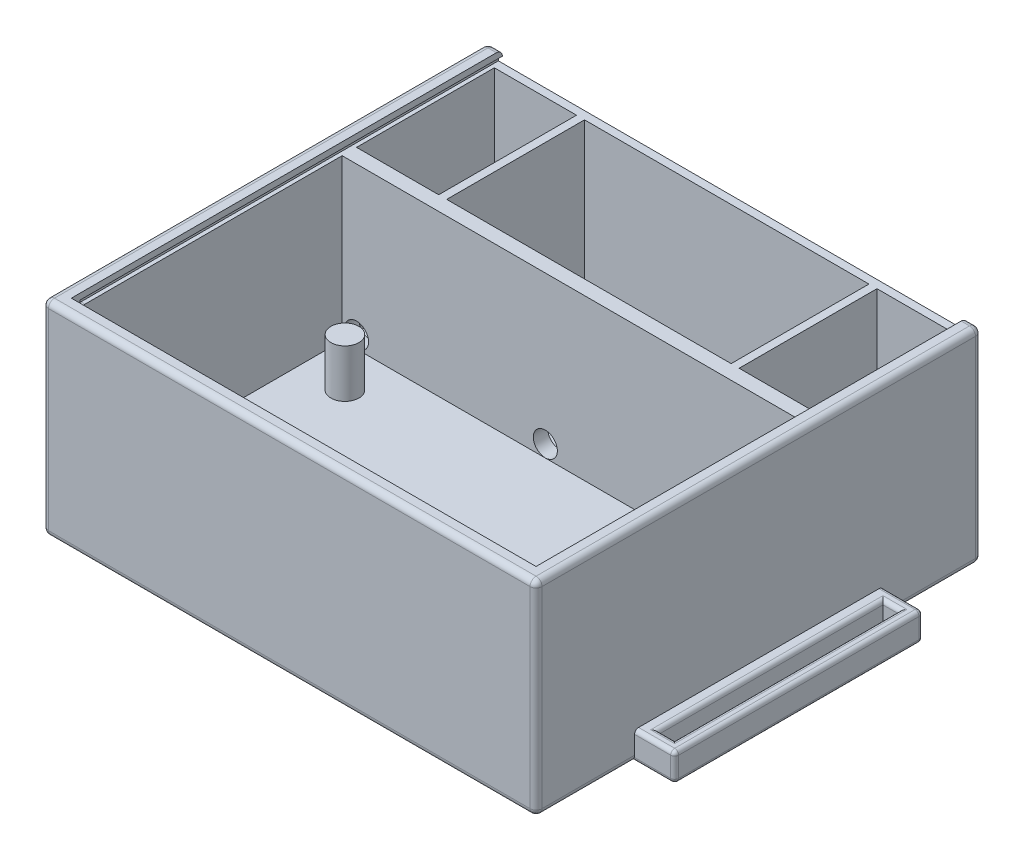
from build123d import *

# Parameters (mm, degrees)
EXTRUDE_THIN1_DEPTH     = 20
ESP_W                   = 57.99999999999999
ESP_H                   = 33.8
EXTRUDE_THIN2_DEPTH     = 20
BOSS_EXTRUDE1_DEPTH     = 4
BOSS_EXTRUDE2_START     = -20
BOSS_EXTRUDE2_DEPTH     = 20
SKETCH5_R               = 9.500000000000002
CUT_EXTRUDE1_DEPTH      = 2
SKETCH7_W               = 1.5
SKETCH7_H               = 9.000000000000004
CUT_EXTRUDE2_DEPTH      = 3.8
CUT_EXTRUDE3_REACH      = 73.504
CUT_EXTRUDE4_REACH      = 74.411
SKETCH9_R               = 1.5000000000000007
SKETCH9_R_2             = 1.5000000000000009
SKETCH9_R_3             = 1.500000000000004
FILLET4_R               = 2
FILLET5_R               = 5
FILLET6_R               = 1
BOSS_EXTRUDE3_DEPTH     = 1.5
CUT_EXTRUDE5_DEPTH      = 0.5
BOSS_EXTRUDE4_DEPTH     = 5
CUT_EXTRUDE6_REACH      = 89.049
SKETCH16_W              = 2
SKETCH16_H              = 27.999999999999993
FILLET8_R               = 0.5
FILLET11_R              = 0.75
SKETCH17_R              = 1.7500000000000038
SKETCH17_R_2            = 1.750000000000002
SKETCH17_R_3            = 1.7499999999999998
SKETCH17_R_4            = 1.7500000000000036
BOSS_EXTRUDE5_DEPTH     = 6
BOSS_EXTRUDE7_START     = -38
BOSS_EXTRUDE7_OUTLINE_R = 1.5
BOSS_EXTRUDE7_DEPTH     = 39
FILLET18_START          = -0.5
FILLET18_DEPTH          = 59
FILLET18_START_2        = -1
FILLET18_2_DEPTH        = 1
FILLET18_START_3        = 58
FILLET18_3_DEPTH        = 1


with BuildPart() as part:
    # Bat → Extrude-Thin1 (new body)
    with BuildSketch(Plane(origin=(0, 0, 0), x_dir=(1, 0, 0), z_dir=(0, 1, 0))):
        Polygon((11.25, 34.8), (11.25, 52.8), (46.75, 52.8), (46.75, 34.8), (47.75, 34.8), (47.75000000000001, 53.8), (10.25, 53.8), (10.25, 34.8), align=None)
    extrude(amount=EXTRUDE_THIN1_DEPTH)

    # ESP → Extrude-Thin2 (add)
    with BuildSketch(Plane(origin=(0, 0, 0), x_dir=(1, 0, 0), z_dir=(0, 1, 0))):
        Polygon((59.79999999999999, 35.599999999999994), (-1.7999999999999972, 35.599999999999994), (-1.8000000000000003, -1.7999999999999972), (59.79999999999999, -1.8), align=None)
        with Locations((28.999999999999996, 16.9)):
            Rectangle(ESP_W, ESP_H, mode=Mode.SUBTRACT)
    extrude(amount=EXTRUDE_THIN2_DEPTH)

    # Sketch1 → Boss-Extrude1 (add)
    with BuildSketch(Plane.XZ):
        Polygon((-1.8, 1.8), (-1.8, -35.6), (-1.7999999999999936, -53.8), (10.249999999999998, -53.8), (47.75, -53.8), (59.8, -53.8), (59.8, -35.6), (59.8, 1.8), align=None)
    extrude(amount=BOSS_EXTRUDE1_DEPTH)

    # Sketch3 → Boss-Extrude2 (add)
    with BuildSketch(Plane(origin=(0, 20, 0), x_dir=(1, 0, 0), z_dir=(0, 1, 0)).offset(BOSS_EXTRUDE2_START)):
        Polygon((57.99999999999999, 33.8), (57.99999999999999, 52.8), (46.75, 52.8), (-6.1e-16, 52.79999999999999), (0, 33.8), (-1.7999999999999978, 27.999999999999996), (-1.7999999999999936, 53.8), (59.8, 53.8), (59.8, 33.8), align=None)
    extrude(amount=BOSS_EXTRUDE2_DEPTH)

    # Sketch5 → Cut-Extrude1 (cut)
    with BuildSketch(Plane.XZ.offset(4)):
        with Locations(Location((28.999999999999996, -23, 0), (0, 0, 270))):
            Circle(SKETCH5_R)
    extrude(amount=-CUT_EXTRUDE1_DEPTH, mode=Mode.SUBTRACT)

    # Sketch7 → Cut-Extrude2 (cut)
    with BuildSketch(Plane(origin=(0, 0, 0), x_dir=(1, 0, 0), z_dir=(0, 1, 0))):
        with Locations((41.59170632111091, 26)):
            Rectangle(SKETCH7_W, SKETCH7_H)
    extrude(amount=-CUT_EXTRUDE2_DEPTH, mode=Mode.SUBTRACT)

    # Sketch8 → Cut-Extrude3 (cut, up to next)
    with BuildSketch(Plane(origin=(40.84170632111091, 0, 0), x_dir=(0, 0, -1), z_dir=(1, 0, 0)), mode=Mode.PRIVATE) as cut_extrude3_sk1:
        Polygon((30.5, -3.8), (30.5, -2), (21.5, -2.0000000000000013), (21.5, -3.8), align=None)
    cut_extrude3_tool1 = extrude(cut_extrude3_sk1.sketch, amount=-CUT_EXTRUDE3_REACH, mode=Mode.PRIVATE) & part.part
    add(cut_extrude3_tool1.solids().sort_by_distance((40.841706, -2.9, -26))[0], mode=Mode.SUBTRACT)

    # Sketch9 → Cut-Extrude4 (cut, up to next)
    with BuildSketch(Plane.XY.offset(-33.8), mode=Mode.PRIVATE) as cut_extrude4_sk1:
        with Locations((25.361352821515197, 1.5199999999999998)):
            Circle(SKETCH9_R)
    cut_extrude4_tool1 = extrude(cut_extrude4_sk1.sketch, amount=-CUT_EXTRUDE4_REACH, mode=Mode.PRIVATE) & part.part
    # Sketch9 → Cut-Extrude4 (cut, up to next)
    with BuildSketch(Plane.XY.offset(-33.8), mode=Mode.PRIVATE) as cut_extrude4_sk2:
        with Locations((1.8, 1.5199999999999998)):
            Circle(SKETCH9_R_2)
    cut_extrude4_tool2 = extrude(cut_extrude4_sk2.sketch, amount=-CUT_EXTRUDE4_REACH, mode=Mode.PRIVATE) & part.part
    # Sketch9 → Cut-Extrude4 (cut, up to next)
    with BuildSketch(Plane.XY.offset(-33.8), mode=Mode.PRIVATE) as cut_extrude4_sk3:
        with Locations((55.99999999999999, 1.5199999999999998)):
            Circle(SKETCH9_R_3)
    cut_extrude4_tool3 = extrude(cut_extrude4_sk3.sketch, amount=-CUT_EXTRUDE4_REACH, mode=Mode.PRIVATE) & part.part
    add(cut_extrude4_tool1.solids().sort_by_distance((25.361353, 1.52, -33.8))[0], mode=Mode.SUBTRACT)
    add(cut_extrude4_tool2.solids().sort_by_distance((1.8, 1.52, -33.8))[0], mode=Mode.SUBTRACT)
    add(cut_extrude4_tool3.solids().sort_by_distance((56, 1.52, -33.8))[0], mode=Mode.SUBTRACT)

    # Fillet4
    fillet4_edges = [part.edges().sort_by_distance(p)[0] for p in [
        (42.34170632111091, -3.8, -26),
    ]]
    fillet(fillet4_edges, radius=FILLET4_R)

    # Fillet5
    # the kernel refuses this fillet: 5 mm, written as the material it takes off along each edge
    with BuildSketch(Plane(origin=(40.84170632111091, -2, -30.5), x_dir=(-1, 2.2e-16, 0), z_dir=(0, -1.5e-16, 1))) as fillet5_piece_1_section:
        with BuildLine():
            CenterArc((4.000000000000001, -5), FILLET5_R, 90.00000000000001, 53.130102354155966)
            Line((4.4e-16, -2.000000000000001), (-0.07999999999999786, -1.9400000000000008))
            ThreePointArc((-0.07999999999999786, -1.9400000000000008), (-0.1000000000000012, -1.0000000000000004), (-0.10000000000000142, -2e-17))
            Line((-0.10000000000000142, -2e-17), (-2e-17, 0.10000000000000009))
            Line((-2e-17, 0.10000000000000009), (4, 0.10000000000000009))
            Line((4, 0.10000000000000009), (4, 0))
        make_face()
    fillet5_piece_1 = extrude(amount=9, mode=Mode.PRIVATE)
    fillet5_piece_1 = fillet5_piece_1 - Plane(origin=(28.999999999999996, -2, -23), x_dir=(-1.8e-16, 0, -1), z_dir=(0, -1, 0)) * Cylinder(9.500000000000002, 34, mode=Mode.PRIVATE)
    add(fillet5_piece_1, mode=Mode.SUBTRACT)
    with BuildSketch(Plane(origin=(40.84170632111091, -2, -30.5), x_dir=(-1, 2.2e-16, 0), z_dir=(0, -1.5e-16, 1))) as fillet5_piece_2_section:
        with BuildLine():
            CenterArc((4.000000000000001, -5), FILLET5_R, 90.00000000000001, 53.130102354155966)
            Line((4.4e-16, -2.000000000000001), (-0.07999999999999786, -1.9400000000000008))
            ThreePointArc((-0.07999999999999786, -1.9400000000000008), (-0.1000000000000012, -1.0000000000000004), (-0.10000000000000142, -2e-17))
            Line((-0.10000000000000142, -2e-17), (-2e-17, 0.10000000000000009))
            Line((-2e-17, 0.10000000000000009), (4, 0.10000000000000009))
            Line((4, 0.10000000000000009), (4, 0))
        make_face()
    fillet5_piece_2 = extrude(amount=9, mode=Mode.PRIVATE)
    fillet5_piece_2 = fillet5_piece_2 & Plane(origin=(28.999999999999996, -2, -23), x_dir=(-1.8e-16, 0, -1), z_dir=(0, -1, 0)) * Cylinder(9.500000000000002, 34, mode=Mode.PRIVATE)
    add(fillet5_piece_2, mode=Mode.SUBTRACT)
    with BuildSketch(Plane(origin=(40.84170632111091, -2, -30.5), x_dir=(-1, 2.2e-16, 0), z_dir=(0, -1.5e-16, 1))) as fillet5_piece_3_section:
        with BuildLine():
            CenterArc((4.000000000000001, -5), FILLET5_R, 90.00000000000001, 53.130102354155966)
            Line((4.4e-16, -2.000000000000001), (-0.07999999999999786, -1.9400000000000008))
            ThreePointArc((-0.07999999999999786, -1.9400000000000008), (-0.1000000000000012, -1.0000000000000004), (-0.10000000000000142, -2e-17))
            Line((-0.10000000000000142, -2e-17), (-2e-17, 0.10000000000000009))
            Line((-2e-17, 0.10000000000000009), (4, 0.10000000000000009))
            Line((4, 0.10000000000000009), (4, 0))
        make_face()
    fillet5_piece_3 = extrude(amount=19, mode=Mode.PRIVATE)
    fillet5_piece_3 = split(fillet5_piece_3, bisect_by=Plane(origin=(40.84170632111091, -2, -21.5), z_dir=(0, 0, 1)), keep=Keep.TOP, mode=Mode.PRIVATE)
    fillet5_piece_3 = fillet5_piece_3 & Plane(origin=(28.999999999999996, -2, -23), x_dir=(-1.8e-16, 0, -1), z_dir=(0, -1, 0)) * Cylinder(9.500000000000002, 54, mode=Mode.PRIVATE)
    add(fillet5_piece_3, mode=Mode.SUBTRACT)

    # Fillet6
    # the kernel refuses this fillet: 1 mm, written as the material it takes off along each edge
    with BuildSketch(Plane(origin=(28.999999999999996, -3.8, -23), x_dir=(0.38724216675287537, 0, -0.9219780389404828), z_dir=(-0.9219780389404828, 0, -0.38724216675287537))) as fillet6_piece_1_section:
        with BuildLine():
            CenterArc((9.500000000000007 + FILLET6_R, FILLET6_R), FILLET6_R, 180, 90)
            Line((9.500000000000007 + FILLET6_R, 0), (9.500000000000007, 0))
            Line((9.500000000000007, 0), (9.500000000000004, FILLET6_R))
        make_face()
    fillet6_piece_1 = revolve(axis=Axis((28.999999999999996, -3.8, -23), (0, -1, 0)), revolution_arc=91.38235177705347, mode=Mode.PRIVATE)
    fillet6_piece_1 = split(fillet6_piece_1, bisect_by=Plane(origin=(28.999999999999996, -3.8, -21.5), z_dir=(0, 0, -1)), keep=Keep.TOP, mode=Mode.PRIVATE)
    fillet6_piece_1 = split(fillet6_piece_1, bisect_by=Plane(origin=(28.999999999999996, -3.8, -30.5), z_dir=(0, 0, 1)), keep=Keep.TOP, mode=Mode.PRIVATE)
    add(fillet6_piece_1, mode=Mode.SUBTRACT)

    # Sketch13 → Boss-Extrude3 (add)
    with BuildSketch(Plane(origin=(0, 20, 0), x_dir=(1, 0, 0), z_dir=(0, 1, 0))):
        Polygon((-1.8, -1.8), (-1.7999999999999936, 53.8), (0, 53.8), (0, 0), (28.999999999999996, 0), (28.999999999999996, -1.7999999999999978), align=None)
    boss_extrude3 = extrude(amount=BOSS_EXTRUDE3_DEPTH)

    # Sketch14 → Cut-Extrude5 (cut)
    with BuildSketch(Plane(origin=(0, 0, 0), x_dir=(0, 0, -1), z_dir=(1, 0, 0))):
        Polygon((53.8, 20), (53.8, 20.75), (1.1000000000000036, 20.74999999999999), (1.1000000000000036, 20.000000000000004), (1.1000000000000036, 19.59999999999999), (1.500000000000004, 19.59999999999999), (1.500000000000004, 19.999999999999996), align=None)
    cut_extrude5 = extrude(amount=-CUT_EXTRUDE5_DEPTH, mode=Mode.SUBTRACT)

    # Sketch15 → Boss-Extrude4 (add)
    with BuildSketch(Plane(origin=(59.8, 0, 0), x_dir=(0, 0, -1), z_dir=(1, 0, 0))):
        Polygon((10.499999999999998, -3.9999999999999982), (41.49999999999999, -3.9999999999999973), (41.49999999999999, -0.4999999999999985), (10.499999999999998, -0.4999999999999985), align=None)
    boss_extrude4 = extrude(amount=BOSS_EXTRUDE4_DEPTH)

    # Sketch16 → Cut-Extrude6 (cut, up to next)
    with BuildSketch(Plane(origin=(0, -0.4999999999999985, 0), x_dir=(1, 0, 0), z_dir=(0, 1, 0)), mode=Mode.PRIVATE) as cut_extrude6_sk1:
        with Locations((62.3, 25.999999999999996)):
            Rectangle(SKETCH16_W, SKETCH16_H)
    cut_extrude6_tool1 = extrude(cut_extrude6_sk1.sketch, amount=-CUT_EXTRUDE6_REACH, mode=Mode.PRIVATE) & part.part
    cut_extrude6 = cut_extrude6_tool1.solids().sort_by_distance((62.3, -0.5, -26))[0]
    add(cut_extrude6, mode=Mode.SUBTRACT)

    # Mirror2: Boss-Extrude3, Cut-Extrude5, Boss-Extrude4, Cut-Extrude6 across plane
    add(boss_extrude3.mirror(Plane(origin=(28.999999999999996, 21.5, 1.7999999999999978), x_dir=(0, 0, 1), z_dir=(-1, 0, 0))))
    add(cut_extrude5.mirror(Plane(origin=(28.999999999999996, 21.5, 1.7999999999999978), x_dir=(0, 0, 1), z_dir=(-1, 0, 0))), mode=Mode.SUBTRACT)
    add(boss_extrude4.mirror(Plane(origin=(28.999999999999996, 21.5, 1.7999999999999978), x_dir=(0, 0, 1), z_dir=(-1, 0, 0))))
    add(cut_extrude6.mirror(Plane(origin=(28.999999999999996, 21.5, 1.7999999999999978), x_dir=(0, 0, 1), z_dir=(-1, 0, 0))), mode=Mode.SUBTRACT)

    # Fillet8
    fillet8_edges = [part.edges().sort_by_distance(p)[0] for p in [
        (62.3, -0.4999999999999985, -10.499999999999998),
        (62.3, -3.9999999999999982, -10.499999999999998),
        (62.3, -3.9999999999999973, -41.49999999999999),
        (62.3, -0.4999999999999985, -41.49999999999999),
        (64.8, -2.2499999999999982, -10.499999999999998),
        (64.8, -3.999999999999998, -25.999999999999993),
        (64.8, -2.2499999999999982, -41.49999999999999),
        (64.8, -0.4999999999999985, -25.999999999999996),
        (63.3, -4, -25.999999999999993),
        (62.3, -4, -11.999999999999998),
        (62.3, -4, -39.99999999999999),
        (63.3, -0.4999999999999985, -25.999999999999993),
        (62.3, -0.4999999999999985, -39.99999999999999),
        (61.3, -0.4999999999999985, -25.999999999999996),
        (62.3, -0.4999999999999985, -11.999999999999998),
        (-6.799999999999997, -2.2499999999999982, -10.499999999999998),
        (-4.300000000000004, -3.9999999999999982, -10.499999999999998),
        (-6.799999999999997, -0.4999999999999985, -25.999999999999996),
        (-4.300000000000004, -0.4999999999999985, -10.499999999999998),
        (-6.799999999999997, -2.2499999999999982, -41.49999999999999),
        (-4.300000000000004, -0.4999999999999985, -41.49999999999999),
        (-6.799999999999997, -3.999999999999998, -25.999999999999993),
        (-4.300000000000004, -3.9999999999999973, -41.49999999999999),
        (-5.300000000000004, -0.4999999999999985, -25.999999999999993),
        (-4.300000000000004, -0.4999999999999985, -39.99999999999999),
        (-3.3000000000000043, -0.4999999999999985, -25.999999999999996),
        (-4.300000000000004, -0.4999999999999985, -11.999999999999998),
        (-4.300000000000004, -4, -11.999999999999998),
        (-5.300000000000004, -4, -25.999999999999993),
        (-4.300000000000004, -4, -39.99999999999999),
    ]]
    fillet(fillet8_edges, radius=FILLET8_R)

    # Fillet11
    fillet11_edges = [part.edges().sort_by_distance(p)[0] for p in [
        (-0.8999999999999968, 21.5, -53.8),
        (-1.7999999999999967, 21.5, -25.999999999999996),
        (28.999999999999996, 21.5, 1.8),
        (59.79999999999999, -4, -4.599999999999999),
        (58.899999999999984, 21.5, -53.8),
        (59.79999999999999, 21.5, -25.999999999999996),
        (-1.7999999999999952, -4, -47.39999999999999),
        (-1.8, 8.75, 1.8),
        (59.8, 8.75, 1.8),
        (-1.7999999999999936, 8.75, -53.8),
        (59.79999999999999, 8.75, -53.8),
        (29, -4, 1.8),
        (-1.7999999999999996, -4, -4.6),
        (29, -4, -53.8),
        (59.8, -4, -47.39999999999999),
    ]]
    fillet(fillet11_edges, radius=FILLET11_R)

    # Sketch17 → Boss-Extrude5 (add)
    with BuildSketch(Plane(origin=(0, 0, 0), x_dir=(1, 0, 0), z_dir=(0, 1, 0))):
        with Locations(Location((52.49999999999999, 28.649999999999995, 0), (0, 0, 90))):
            Circle(SKETCH17_R)
        with Locations(Location((5.499999999999991, 28.649999999999995, 0), (0, 0, 90))):
            Circle(SKETCH17_R_2)
        with Locations(Location((5.499999999999991, 5.149999999999997, 0), (0, 0, 90))):
            Circle(SKETCH17_R_3)
        with Locations(Location((52.49999999999999, 5.149999999999997, 0), (0, 0, 90))):
            Circle(SKETCH17_R_4)
    extrude(amount=BOSS_EXTRUDE5_DEPTH)

    # Boss-Extrude7: read off the stored shape, not the designer's step
    # Boss-Extrude7 outline → Boss-Extrude7 (cut)
    with BuildSketch(Plane(origin=(47.75, 0, 0), x_dir=(0, 0, -1), z_dir=(1, 0, 0)).offset(BOSS_EXTRUDE7_START)):
        with Locations((38.877460217, 6.974486586)):
            Circle(BOSS_EXTRUDE7_OUTLINE_R)
    extrude(amount=BOSS_EXTRUDE7_DEPTH, mode=Mode.SUBTRACT)

    # Fillet18: read off the stored shape, not the designer's step
    # Fillet18 outline → Fillet18 (cut)
    with BuildSketch(Plane.YZ.offset(FILLET18_START)):
        with BuildLine():
            Line((20, -1.5), (19.8, -1.5))
            ThreePointArc((19.8, -1.5), (19.941421356, -1.558578644), (20, -1.7))
            Line((20, -1.7), (20, -1.5))
        make_face()
    extrude(amount=FILLET18_DEPTH, mode=Mode.SUBTRACT)

    # Fillet18 2 outline → Fillet18 2 (add)
    with BuildSketch(Plane.YZ.offset(FILLET18_START_2)):
        with BuildLine():
            Line((19.6, -1.5), (19.8, -1.5))
            ThreePointArc((19.8, -1.5), (19.658578644, -1.441421356), (19.6, -1.3))
            Line((19.6, -1.3), (19.6, -1.5))
        make_face()
    extrude(amount=FILLET18_2_DEPTH)

    # Fillet18 3 outline → Fillet18 3 (add)
    with BuildSketch(Plane.YZ.offset(FILLET18_START_3)):
        with BuildLine():
            Line((19.6, -1.5), (19.8, -1.5))
            ThreePointArc((19.8, -1.5), (19.658578644, -1.441421356), (19.6, -1.3))
            Line((19.6, -1.3), (19.6, -1.5))
        make_face()
    extrude(amount=FILLET18_3_DEPTH)


solid = part.part
